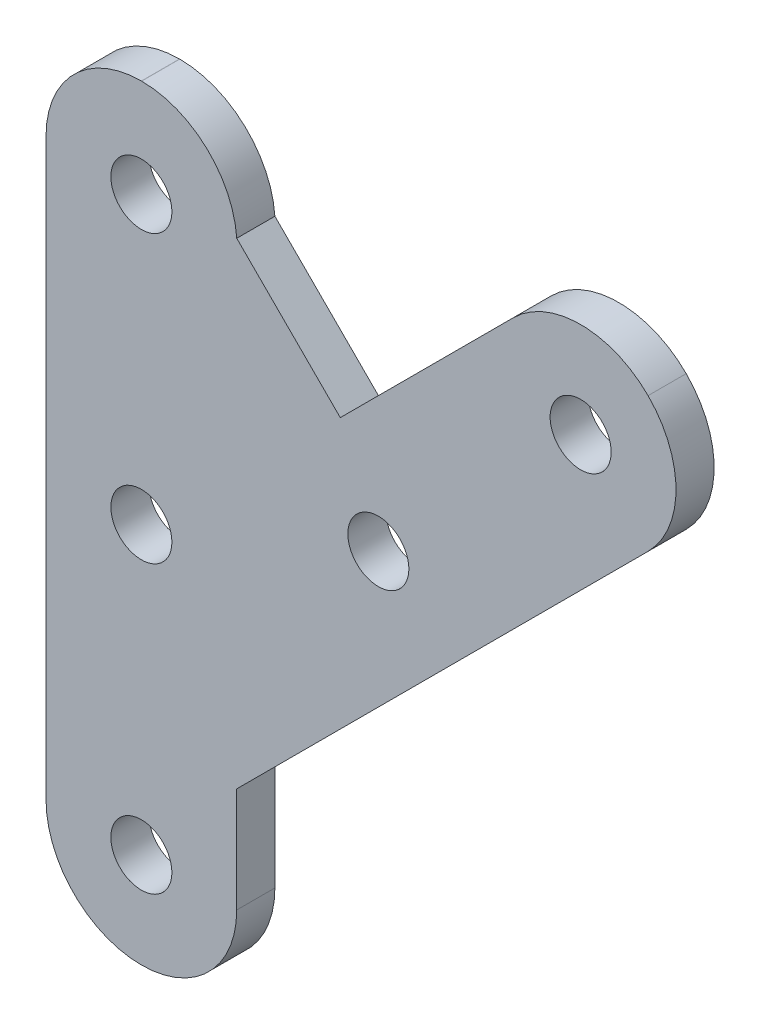
from build123d import *

# Parameters (mm, degrees)
EXTRUDE_1_DEPTH     = 1
FILLET_1_R          = 5
SKETCH_2_R          = 1.6
CUT_EXTRUDE_1_DEPTH = 36.923820844


with BuildPart() as part:
    # ｽｹｯﾁ1 → ﾎﾞｽ - 押し出し1 (new, symmetric)
    with BuildSketch(Plane.XY):
        Polygon((-3.827856705, 20.364933264), (-3.827856705, -19.777202359), (6.172143295, -19.777202359), (6.172143295, -9.277202359), (31.274434027, 15.825088373), (24.203366215, 22.896156185), (11.601075483, 10.293865452), (6.172143295, 15.722797641), (6.172143295, 20.364933264), align=None)
    extrude(amount=EXTRUDE_1_DEPTH, both=True)

    # ﾌｨﾚｯﾄ1
    # the kernel refuses this fillet: 5 mm, written as the material it takes off along each edge
    with BuildSketch(Plane(origin=(24.203366215, 22.896156185, -13.5), x_dir=(-0.7071067811865422, -0.7071067811865529, 0), z_dir=(0, 0, 1)), Plane(origin=(-3.827856705, -19.777202359, -13.5), x_dir=(1, 0, 0), z_dir=(0, 0, 1)), Plane(origin=(6.172143295, -19.777202359, -13.5), x_dir=(0, 1, 0), z_dir=(0, 0, 1)), Plane(origin=(31.274434027, 15.825088373, -13.5), x_dir=(-0.7071067811865479, 0.7071067811865471, 0), z_dir=(0, 0, 1))) as fillet_1_piece_1:
        with BuildLine():
            CenterArc((FILLET_1_R, FILLET_1_R), FILLET_1_R, 180, 90)
            Line((0, FILLET_1_R), (-FILLET_1_R * 0.02, FILLET_1_R))
            Line((-FILLET_1_R * 0.02, FILLET_1_R), (-FILLET_1_R * 0.02, -FILLET_1_R * 0.02))
            Line((-FILLET_1_R * 0.02, -FILLET_1_R * 0.02), (FILLET_1_R, -FILLET_1_R * 0.02))
            Line((FILLET_1_R, -FILLET_1_R * 0.02), (FILLET_1_R, 0))
        make_face()
    extrude(amount=27, mode=Mode.SUBTRACT)
    with BuildSketch(Plane(origin=(-3.827856705, 20.364933264, -13.5), x_dir=(1, 0, 0), z_dir=(0, 0, 1))) as fillet_1_piece_2:
        with BuildLine():
            CenterArc((FILLET_1_R, -FILLET_1_R), FILLET_1_R, 90, 90)
            Line((0, -FILLET_1_R), (-FILLET_1_R * 0.02, -FILLET_1_R))
            Line((-FILLET_1_R * 0.02, -FILLET_1_R), (-FILLET_1_R * 0.02, FILLET_1_R * 0.02))
            Line((-FILLET_1_R * 0.02, FILLET_1_R * 0.02), (FILLET_1_R, FILLET_1_R * 0.02))
            Line((FILLET_1_R, FILLET_1_R * 0.02), (FILLET_1_R, 0))
        make_face()
    extrude(amount=27, mode=Mode.SUBTRACT)
    with BuildSketch(Plane(origin=(6.172143295, 20.364933264, 13.467942164), x_dir=(-1, 0, 0), z_dir=(0, 0, -1))) as fillet_1_piece_3:
        with BuildLine():
            CenterArc((4.987176866, -5), FILLET_1_R, 90, 85.895667026)
            Line((0, -4.642135624), (-0.099743537, -4.634978336))
            ThreePointArc((-0.099743537, -4.634978336), (-0.1, -2.321067812), (-0.1, 0))
            Line((-0.1, 0), (0, 0.1))
            Line((0, 0.1), (4.987176866, 0.1))
            Line((4.987176866, 0.1), (4.987176866, 0))
        make_face()
    extrude(amount=26.935884328, mode=Mode.SUBTRACT)

    # ｽｹｯﾁ2 → ｶｯﾄ - 押し出し1 (cut, through all)
    with BuildSketch(Plane.XY.offset(1)):
        with Locations((1.171422694, -14.777202359)):
            Circle(SKETCH_2_R)
        with Locations((13.596764497, 5.218486655)):
            Circle(SKETCH_2_R)
        with Locations((24.203366215, 15.825088373)):
            Circle(SKETCH_2_R)
        with Locations((1.171422694, 0.222797641)):
            Circle(SKETCH_2_R)
        with Locations((1.171422694, 15.222797641)):
            Circle(SKETCH_2_R)
    extrude(amount=-CUT_EXTRUDE_1_DEPTH, mode=Mode.SUBTRACT)


solid = part.part
